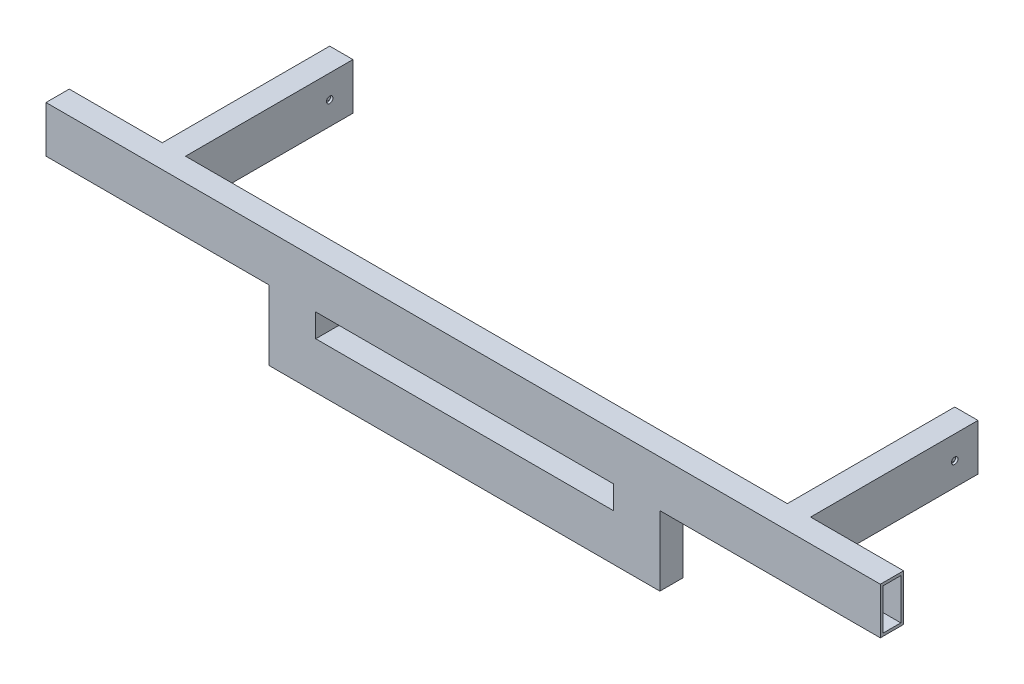
from build123d import *

# Parameters (mm, degrees)
SKETCH1_W               = 320
SKETCH1_H               = 25
BOSS_EXTRUDE1_DEPTH     = 25
SHELL1_T                = -3
SKETCH5_W               = 3
SKETCH5_H               = 50
BOSS_EXTRUDE3_DEPTH     = 50
CUT_EXTRUDE1_DEPTH      = 546.915466805
CUT_EXTRUDE1_DEPTH_BACK = 546.915466805
SKETCH6_R               = 3.5
SKETCH7_W               = 25
SKETCH7_H               = 50
SKETCH7_W_2             = 20
SKETCH7_H_2             = 45
EXTRUDE_THIN1_DEPTH     = 180
CUT_EXTRUDE2_DEPTH      = 820.470986001
CUT_EXTRUDE2_DEPTH_BACK = 820.470986001
SKETCH8_R               = 3.5


with BuildPart() as part:
    # Sketch1 → Boss-Extrude1 (new body)
    with BuildSketch(Plane.XY):
        Polygon((351.917253095, 12.639419675), (588.917253095, 12.639419675), (588.917253095, 62.639419675), (-308.082746905, 62.639419675), (-308.082746905, 12.639419675), (-68.082746905, 12.639419675), (-68.082746905, -62.360580325), (351.917253095, -62.360580325), align=None)
        with Locations((141.917253095, 0.139419675)):
            Rectangle(SKETCH1_W, SKETCH1_H, mode=Mode.SUBTRACT)
    extrude(amount=BOSS_EXTRUDE1_DEPTH)

    # Shell1
    shell1_openings = [part.faces().sort_by_distance(p)[0] for p in [
        (-308.082746905, 37.639419675, 12.5),
        (588.917253095, 37.639419675, 12.5),
    ]]
    offset(amount=SHELL1_T, openings=shell1_openings, kind=Kind.INTERSECTION)

    # Sketch5 → Boss-Extrude3 (add)
    with BuildSketch(Plane(origin=(0, 0, 0), x_dir=(-1, 0, 0), z_dir=(0, 0, -1))):
        with Locations((-230.417253095, -37.360580325)):
            Rectangle(SKETCH5_W, SKETCH5_H)
        with Locations((-200.417253095, -37.360580325)):
            Rectangle(SKETCH5_W, SKETCH5_H)
        with Locations((-75.417253095, -37.360580325)):
            Rectangle(SKETCH5_W, SKETCH5_H)
        with Locations((-45.417253095, -37.360580325)):
            Rectangle(SKETCH5_W, SKETCH5_H)
    extrude(amount=BOSS_EXTRUDE3_DEPTH)

    # Sketch6 → Cut-Extrude1 (cut, two sides: drawn at the far end of the back side and taken through both)
    with BuildSketch(Plane(origin=(231.917253095, 0, 0), x_dir=(0, 0, -1), z_dir=(1, 0, 0)).offset(-CUT_EXTRUDE1_DEPTH_BACK)):
        with Locations((40, -35.438653819)):
            Circle(SKETCH6_R)
    extrude(amount=CUT_EXTRUDE1_DEPTH + CUT_EXTRUDE1_DEPTH_BACK, mode=Mode.SUBTRACT)

    # Sketch7 → Extrude-Thin1 (add)
    # profile 1 of 2: a face of its own
    with BuildSketch(Plane(origin=(0, 0, 0), x_dir=(-1, 0, 0), z_dir=(0, 0, -1))):
        with Locations((-476.417253095, 37.639419675)):
            Rectangle(SKETCH7_W, SKETCH7_H)
        with Locations((-476.417253095, 37.639419675)):
            Rectangle(SKETCH7_W_2, SKETCH7_H_2, mode=Mode.SUBTRACT)
    # profile 2 of 2: a face of its own
    with BuildSketch(Plane(origin=(0, 0, 0), x_dir=(-1, 0, 0), z_dir=(0, 0, -1))):
        with Locations((195.582746905, 37.639419675)):
            Rectangle(SKETCH7_W, SKETCH7_H)
        with Locations((195.582746905, 37.639419675)):
            Rectangle(SKETCH7_W_2, SKETCH7_H_2, mode=Mode.SUBTRACT)
    extrude(amount=EXTRUDE_THIN1_DEPTH)

    # Sketch8 → Cut-Extrude2 (cut, two sides: drawn at the far end of the back side and taken through both)
    with BuildSketch(Plane.ZY.offset(208.082746905).offset(-CUT_EXTRUDE2_DEPTH_BACK)):
        with Locations((-155, 37.639419675)):
            Circle(SKETCH8_R)
    extrude(amount=CUT_EXTRUDE2_DEPTH + CUT_EXTRUDE2_DEPTH_BACK, mode=Mode.SUBTRACT)


solid = part.part
